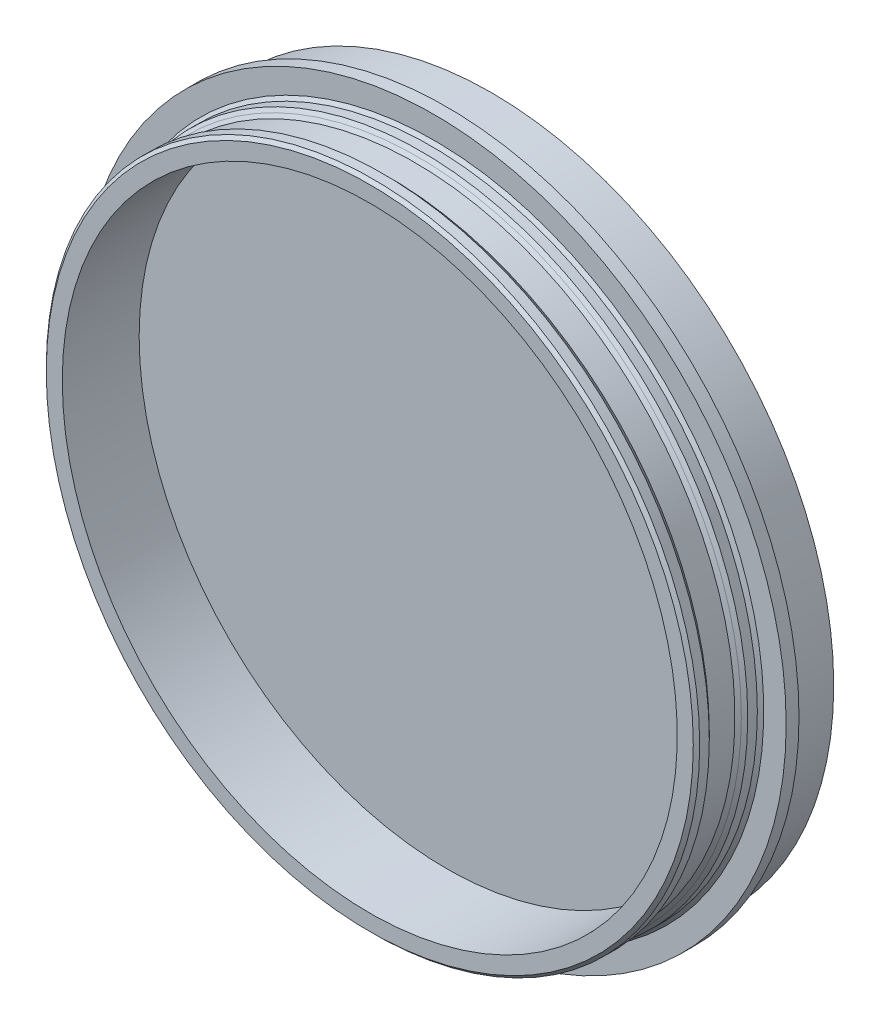
from build123d import *

# Parameters (mm, degrees)
CHAMFER1_SIZE       = 0.5
BOSS_EXTRUDE1_START = 7
SKETCH2_R           = 53.425
BOSS_EXTRUDE1_DEPTH = 7


with BuildPart() as part:
    # Sketch1 → Revolve1 (revolve)
    with BuildSketch(Plane(origin=(0, 0, 0), x_dir=(1, 0, 0), z_dir=(0, 1, 0)), mode=Mode.PRIVATE) as revolve1_sk:
        Polygon((50.425, 19), (50.425, 14), (48, 14), (48, 0), (51, 0), (51, 2.5), (50, 2.5), (50, 7.5), (51, 7.5), (51, 10), (55, 10), (55, 12), (53.425, 12), (53.425, 19), align=None)
    revolve(revolve1_sk.sketch.rotate(Axis((0, 0, -69.169847328), (0, 0, 1)), 180), axis=Axis((0, 0, -69.169847328), (0, 0, 1)))

    # Chamfer1
    chamfer1_edges = [part.edges().sort_by_distance(p)[0] for p in [
        (51, 0, -10),
        (51, 0, -7.5),
        (50, 0, -7.5),
        (50, 0, -2.5),
        (51, 0, -2.5),
        (51, 0, 0),
        (50.425, 0, -19),
        (53.425, 0, -19),
    ]]
    chamfer(chamfer1_edges, length=CHAMFER1_SIZE - 0.0001)  # a hair under: the kernel refuses the full size

    # Sketch2 → Boss-Extrude1 (add)
    with BuildSketch(Plane(origin=(0, 0, -12), x_dir=(-1, 0, 0), z_dir=(0, 0, -1)).offset(BOSS_EXTRUDE1_START)):
        Circle(SKETCH2_R)
    extrude(amount=-BOSS_EXTRUDE1_DEPTH)


solid = part.part
